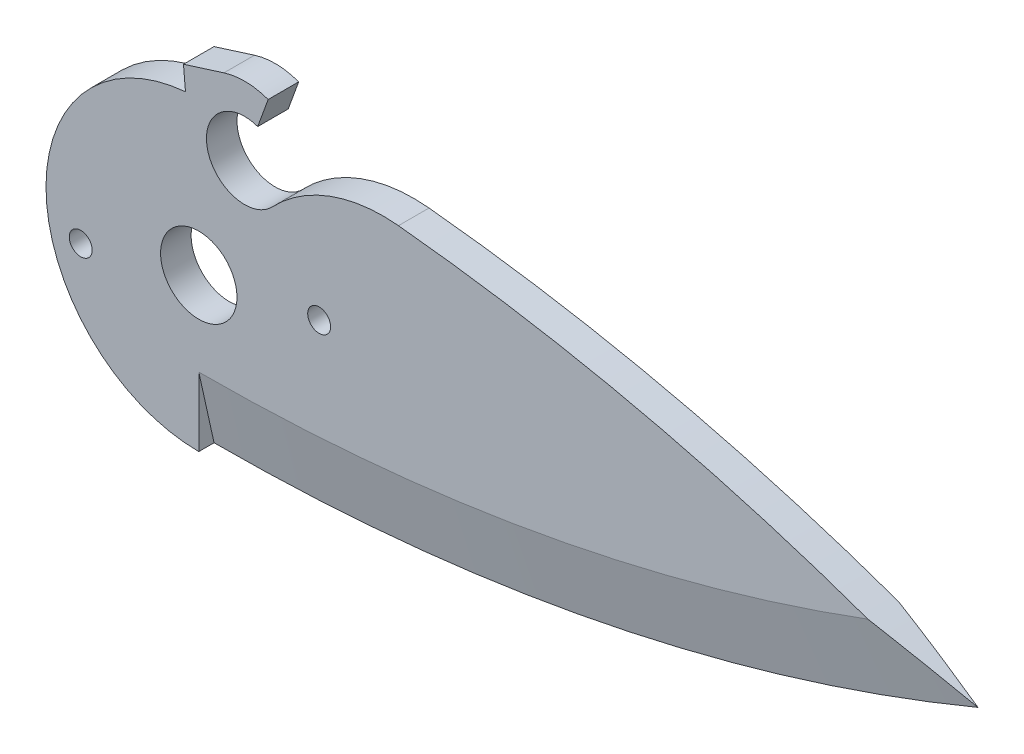
from build123d import *

# Parameters (mm, degrees)
SKICA1_R                      = 2.5
P_IDAT_VYSUNUT_M1_DEPTH       = 1
ODEBRAT_VYSUNUT_M1_DEPTH      = 52.548520832
ODEBRAT_VYSUNUT_M1_DEPTH_BACK = 52.548520832
SKICA4_R                      = 0.75


with BuildPart() as part:
    # Skica1 → Přidat vysunutím1 (new, symmetric)
    with BuildSketch(Plane.XY):
        with BuildLine():
            Line((1.646493053, 12.291621948), (-1.002291042, 11.456239028))
            Line((-1.002291042, 11.456239028), (-0.871557427, 9.961946981))
            ThreePointArc((-0.871557427, 9.961946981), (-7.372773368, 6.755902076), (-10, 0))
            ThreePointArc((-10, 0), (-7.071067812, -7.071067812), (0, -10))
            ThreePointArc((0, -10), (25.495097568, -7.47548784), (50, 0))
            ThreePointArc((50, 0), (31.878604545, 6.030768355), (13.069168565, 9.34139644))
            ThreePointArc((13.069168565, 9.34139644), (8.585652805, 8.76767337), (4.812769581, 6.27841165))
            ThreePointArc((4.812769581, 6.27841165), (0.566440986, 7.427470066), (3.855050358, 10.349231552))
            Line((3.855050358, 10.349231552), (4.539090645, 12.228616794))
            ThreePointArc((4.539090645, 12.228616794), (3.097993569, 12.498932902), (1.646493053, 12.291621948))
        make_face()
        Circle(SKICA1_R, mode=Mode.SUBTRACT)
    extrude(amount=P_IDAT_VYSUNUT_M1_DEPTH, both=True)

    # Skica4 → Odebrat vysunutím1 (cut, two sides: drawn at the far end of the back side and taken through both)
    with BuildSketch(Plane.XY.offset(-ODEBRAT_VYSUNUT_M1_DEPTH_BACK)):
        with Locations((7.878462024, 1.389185421)):
            Circle(SKICA4_R)
        with Locations((-7.72740661, -2.070552361)):
            Circle(SKICA4_R)
    extrude(amount=ODEBRAT_VYSUNUT_M1_DEPTH + ODEBRAT_VYSUNUT_M1_DEPTH_BACK, mode=Mode.SUBTRACT)

    # Odebrat tažením po křivce1: sweep along a path in Skica3
    with BuildLine(Plane.XY) as odebrat_ta_en_m_po_k_ivce1_path:
        ThreePointArc((0, -10), (25.495097568, -7.47548784), (50, 0))
    # Skica2 → Odebrat tažením po křivce1 (sweep, cut)
    with BuildSketch(Plane(origin=(0, 0, 0), x_dir=(0, 0, -1), z_dir=(1, 0, 0))):
        Polygon((0, -10), (-1, -5.489291496), (-1, -10), align=None)
    odebrat_ta_en_m_po_k_ivce1 = sweep(path=odebrat_ta_en_m_po_k_ivce1_path.line, mode=Mode.SUBTRACT)

    # Zrcadlit1: Odebrat tažením po křivce1 across plane
    add(odebrat_ta_en_m_po_k_ivce1.mirror(Plane.XY), mode=Mode.SUBTRACT)


solid = part.part
